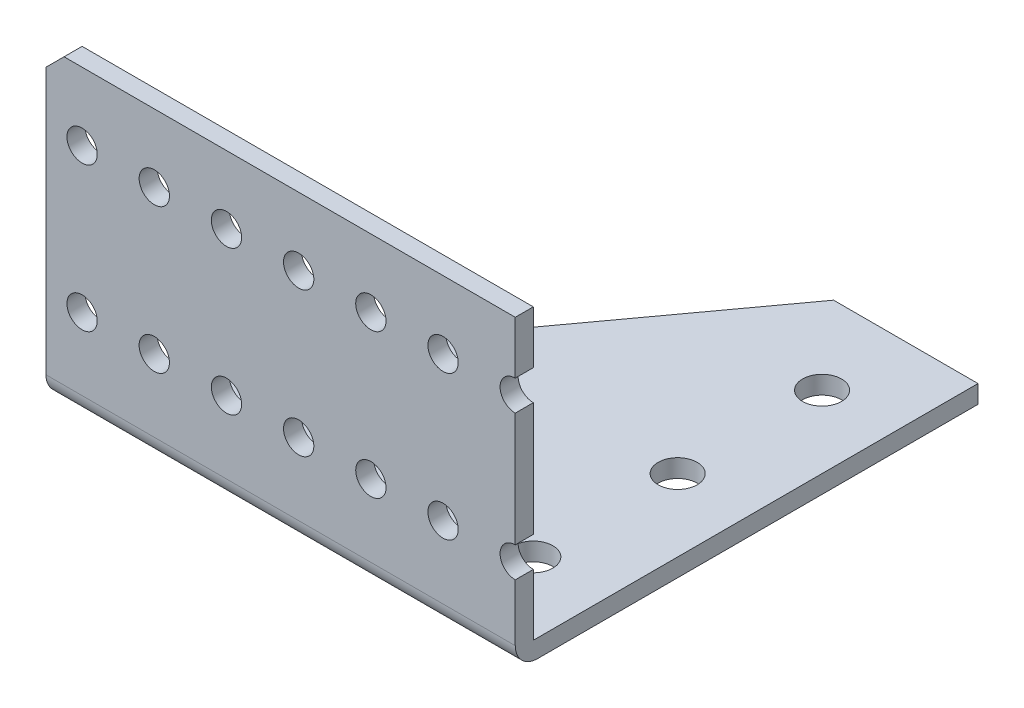
from build123d import *

# Parameters (mm, degrees)
BOSS_EXTRUDE1_START    = -34.925
SKETCH1_W              = 82.55
SKETCH1_H              = 81.407
BOSS_EXTRUDE1_DEPTH    = 3.175
SKETCH3_W              = 82.55
SKETCH3_H              = 3.175
BOSS_EXTRUDE2_DEPTH    = 50.8
F_10_CLEARANCE_HOLE2_D = 5.334
CHAMFER1_SIZE          = 3.175
FILLET2_R              = 3.937
SKETCH9_R              = 3.429
CUT_EXTRUDE2_DEPTH     = 80.206698973


with BuildPart() as part:
    # Sketch1 → Boss-Extrude1 (new body)
    with BuildSketch(Plane(origin=(0, 0, 0), x_dir=(1, 0, 0), z_dir=(0, 1, 0)).offset(BOSS_EXTRUDE1_START)):
        Rectangle(SKETCH1_W, SKETCH1_H)
    extrude(amount=BOSS_EXTRUDE1_DEPTH)

    # Sketch3 → Boss-Extrude2 (add)
    with BuildSketch(Plane(origin=(0, -31.75, 0), x_dir=(1, 0, 0), z_dir=(0, 1, 0))):
        with Locations((0, -39.116)):
            Rectangle(SKETCH3_W, SKETCH3_H)
    extrude(amount=BOSS_EXTRUDE2_DEPTH)

    # #10 Clearance Hole2 (through all)
    with Locations(Plane(origin=(0, 0, -40.7035), x_dir=(-1, 0, 0), z_dir=(0, 0, -1))):
        with Locations((22.225, 7.112), (9.525, 7.112), (-3.175, 7.112), (-15.875, 7.112), (-28.575, 7.112), (22.225, -18.288), (9.525, -18.288), (-3.175, -18.288), (-15.875, -18.288), (-28.575, -18.288), (34.925, 7.112), (34.925, -18.288), (-41.275, 7.112), (-41.275, -18.288)):
            Hole(F_10_CLEARANCE_HOLE2_D / 2)

    # Chamfer1
    chamfer1_edges = [part.edges().sort_by_distance(p)[0] for p in [
        (-41.275, 19.05, 39.116),
    ]]
    chamfer(chamfer1_edges, length=CHAMFER1_SIZE)

    # Fillet2
    fillet2_edges = [part.edges().sort_by_distance(p)[0] for p in [
        (0, -34.925, 40.7035),
    ]]
    fillet(fillet2_edges, radius=FILLET2_R)

    # Sketch9 → Cut-Extrude2 (cut, through all)
    with BuildSketch(Plane.XZ.offset(34.925)):
        with Locations((28.575, 24.8285)):
            Circle(SKETCH9_R)
        with Locations((28.575, -0.5715)):
            Circle(SKETCH9_R)
        with Locations((28.575, -25.9715)):
            Circle(SKETCH9_R)
        Polygon((-41.275, 37.5285), (15.875, -40.7035), (-41.275, -40.7035), align=None)
    extrude(amount=-CUT_EXTRUDE2_DEPTH, mode=Mode.SUBTRACT)


solid = part.part
